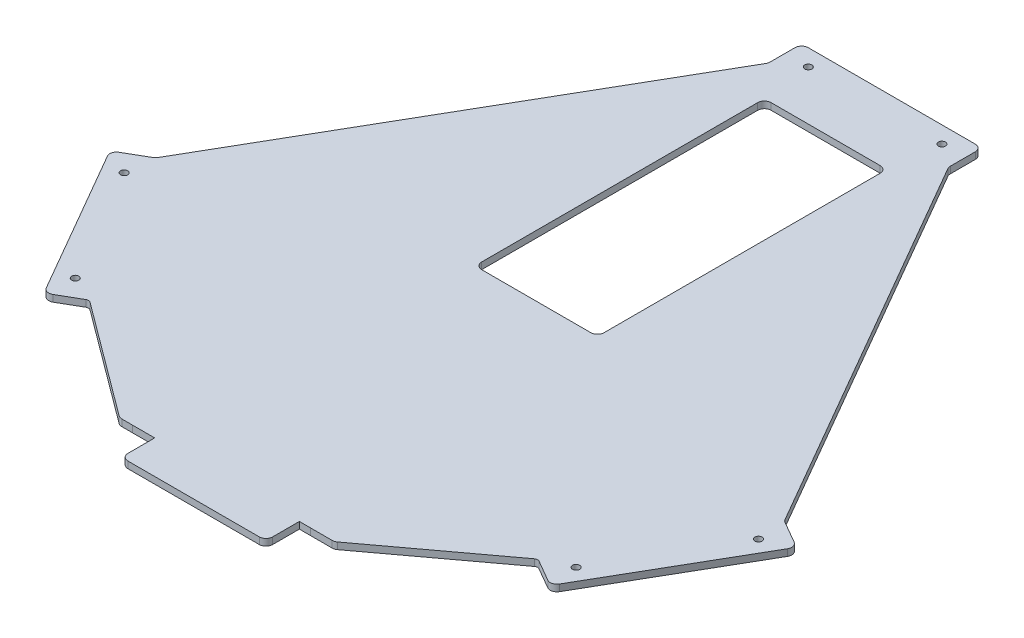
from build123d import *

# Parameters (mm, degrees)
EXTRUDE_1_DEPTH          = 1.5
FILLET_1_R               = 3
SKETCH_4_R               = 1.6
CUT_EXTRUDE_1_DEPTH      = 3
PATTERN_CIRCULAR_1_COUNT = 3
EXTRUDE_2_DEPTH          = 3
FILLET_2_R               = 3
SKETCH_6_W               = 55
SKETCH_6_H               = 130
CUT_EXTRUDE_2_DEPTH      = 10
FILLET_3_R               = 3


with BuildPart() as part:
    # ｽｹｯﾁ3 → ﾎﾞｽ - 押し出し1 (new, symmetric)
    with BuildSketch(Plane(origin=(0, 0, 0), x_dir=(1, 0, 0), z_dir=(0, 1, 0))):
        Polygon((-40.5, 154.723486296), (-40.5, 139.723486296), (-141.254088638, -34.787714295), (-154.244469695, -42.287714295), (-113.744469695, -112.435772001), (-100.754088638, -104.935772001), (100.754088638, -104.935772001), (113.744469695, -112.435772001), (154.244469695, -42.287714295), (141.254088638, -34.787714295), (40.5, 139.723486296), (40.5, 154.723486296), align=None)
    extrude(amount=EXTRUDE_1_DEPTH, both=True)

    # ﾌｨﾚｯﾄ1
    fillet_1_edges = [part.edges().sort_by_distance(p)[0] for p in [
        (141.254088638, 0, 34.787714295),
        (154.244469695, 0, 42.287714295),
        (113.744469695, 0, 112.435772001),
        (100.754088638, 0, 104.935772001),
        (-100.754088638, 0, 104.935772001),
        (-154.244469695, 0, 42.287714295),
        (-141.254088638, 0, 34.787714295),
        (-40.5, 0, -139.723486296),
        (-40.5, 0, -154.723486296),
        (40.5, 0, -154.723486296),
        (40.5, 0, -139.723486296),
        (-113.744469695, 0, 112.435772001),
    ]]
    fillet(fillet_1_edges, radius=FILLET_1_R)

    # ｽｹｯﾁ4 → ｶｯﾄ - 押し出し1 (cut)
    with BuildSketch(Plane(origin=(0, 1.5, 0), x_dir=(1, 0, 0), z_dir=(0, 1, 0))):
        with Locations((-30, 147.223486296)):
            Circle(SKETCH_4_R)
        with Locations((30, 147.223486296)):
            Circle(SKETCH_4_R)
    cut_extrude_1 = extrude(amount=-CUT_EXTRUDE_1_DEPTH, mode=Mode.SUBTRACT)

    # 円形ﾊﾟﾀｰﾝ1: ｶｯﾄ - 押し出し1 ×3 about axis
    pattern_circular_1_axis = Axis((0, -1.65, 0), (0, 1, 0))
    for i in range(1, PATTERN_CIRCULAR_1_COUNT):
        add(cut_extrude_1.rotate(pattern_circular_1_axis, i * 360 / PATTERN_CIRCULAR_1_COUNT), mode=Mode.SUBTRACT)

    # ｽｹｯﾁ6 → ｶｯﾄ - 押し出し2 (cut)
    with BuildSketch(Plane.XZ.offset(1.5)):
        with Locations((0, -60)):
            Rectangle(SKETCH_6_W, SKETCH_6_H)
    extrude(amount=-CUT_EXTRUDE_2_DEPTH, mode=Mode.SUBTRACT)

    # ﾌｨﾚｯﾄ3
    fillet_3_edges = [part.edges().sort_by_distance(p)[0] for p in [
        (27.5, 0, -125),
        (-27.5, 0, -125),
        (-27.5, 0, 5),
        (27.5, 0, 5),
    ]]
    fillet(fillet_3_edges, radius=FILLET_3_R)


with BuildPart() as body_2:
    # ｽｹｯﾁ5 → ﾎﾞｽ - 押し出し2 (new body)
    with BuildSketch(Plane(origin=(0, 1.5, 0), x_dir=(1, 0, 0), z_dir=(0, 1, 0))):
        with BuildLine():
            ThreePointArc((99.83129569, -105.620768118), (100.773829498, -105.278829695), (101.749364921, -105.510395031))
            Line((101.749364921, -105.510395031), (101.450241061, -105.33769579))
            ThreePointArc((101.450241061, -105.33769579), (100.726698196, -105.037994523), (99.950241061, -104.935772001))
            Line((99.950241061, -104.935772001), (-99.950241061, -104.935772001))
            ThreePointArc((-99.950241061, -104.935772001), (-100.726698196, -105.037994523), (-101.450241061, -105.33769579))
            Line((-101.450241061, -105.33769579), (-101.749364921, -105.510395031))
            ThreePointArc((-101.749364921, -105.510395031), (-100.773829498, -105.278829695), (-99.83129569, -105.620768118))
            Line((-99.83129569, -105.620768118), (-48.961019407, -143.382155168))
            ThreePointArc((-48.961019407, -143.382155168), (-48.699689031, -143.620689634), (-48.491681343, -143.906915172))
            Line((-48.491681343, -143.906915172), (-42.499500011, -143.906915172))
            Line((-42.499500011, -143.906915172), (-42.499499989, -143.906581855))
            Line((-42.499499989, -143.906581855), (-32.499500011, -143.907248522))
            Line((-32.499500011, -143.907248522), (-32.500499989, -158.906915172))
            Line((-32.500499989, -158.906915172), (32.499500156, -158.906915172))
            Line((32.499500156, -158.906915172), (32.500500178, -143.906581855))
            Line((32.500500178, -143.906581855), (37.500250255, -143.906915172))
            Line((37.500250255, -143.906915172), (48.491681343, -143.906915172))
            ThreePointArc((48.491681343, -143.906915172), (48.699689031, -143.620689634), (48.961019407, -143.382155168))
            Line((48.961019407, -143.382155168), (99.83129569, -105.620768118))
        make_face()
    extrude(amount=-EXTRUDE_2_DEPTH)

    # ﾌｨﾚｯﾄ2
    fillet_2_edges = [body_2.edges().sort_by_distance(p)[0] for p in [
        (48.491681343, 0, 143.906915172),
        (32.499500156, 0, 158.906915172),
        (-32.500499989, 0, 158.906915172),
        (-48.491681343, 0, 143.906915172),
    ]]
    fillet(fillet_2_edges, radius=FILLET_2_R)

    # Combine 1: union part
    add(part.part)


solid = body_2.part
